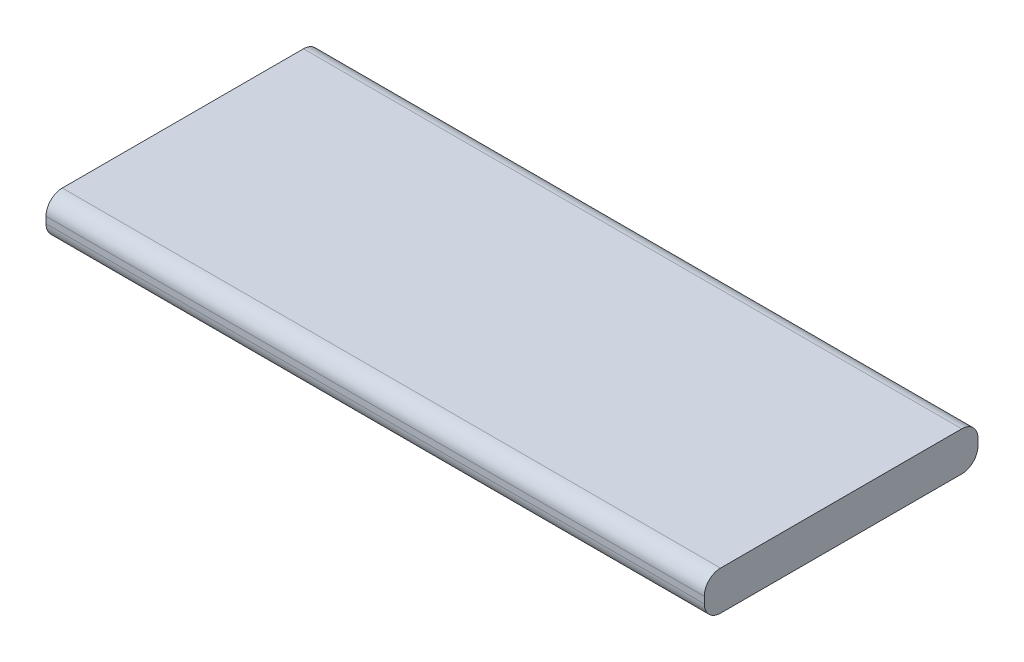
from build123d import *

# Parameters (mm, degrees)
SKETCH1_W           = 10.1
SKETCH1_H           = 4.2
BOSS_EXTRUDE1_DEPTH = 0.6
FILLET1_R           = 0.25
FILLET2_R           = 0.25


with BuildPart() as part:
    # Sketch1 → Boss-Extrude1 (new body)
    with BuildSketch(Plane(origin=(0, 0, 0), x_dir=(1, 0, 0), z_dir=(0, 1, 0))):
        Rectangle(SKETCH1_W, SKETCH1_H)
    extrude(amount=BOSS_EXTRUDE1_DEPTH)

    # Fillet1
    fillet1_edges = [part.edges().sort_by_distance(p)[0] for p in [
        (0, 0.6, -2.1),
        (0, 0.6, 2.1),
    ]]
    fillet(fillet1_edges, radius=FILLET1_R)

    # Fillet2
    fillet2_edges = [part.edges().sort_by_distance(p)[0] for p in [
        (0, 0, 2.1),
        (0, 0, -2.1),
    ]]
    fillet(fillet2_edges, radius=FILLET2_R)


solid = part.part
